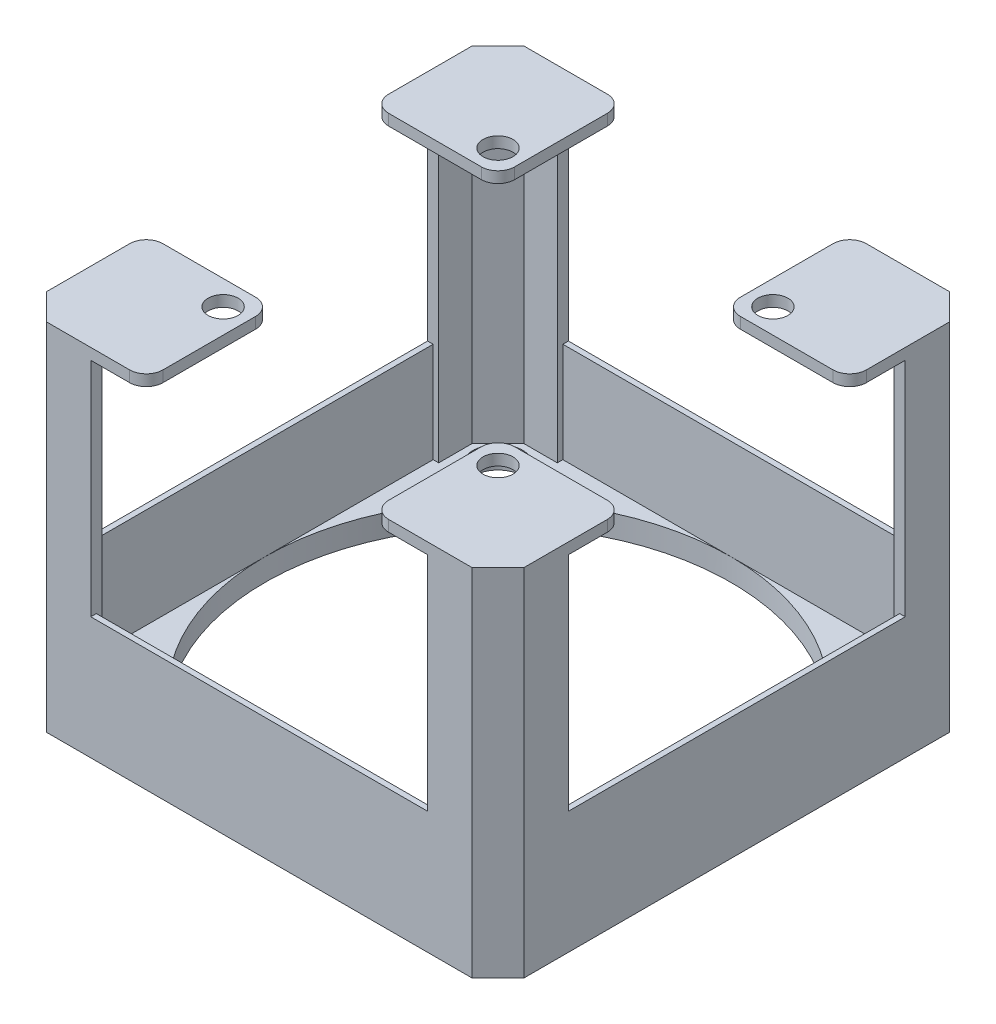
from build123d import *

# Parameters (mm, degrees)
SKETCH1_R           = 21
BOSS_EXTRUDE1_DEPTH = 2
BOSS_EXTRUDE6_DEPTH = 30
SKETCH13_W          = 30.324405
SKETCH13_H          = 0.5
SKETCH13_W_2        = 0.5
SKETCH13_H_2        = 30.324404
SKETCH13_W_3        = 30.32440476
SKETCH13_H_3        = 0.50000019
BOSS_EXTRUDE7_DEPTH = 9
SKETCH15_R          = 1.35
BOSS_EXTRUDE9_DEPTH = 1
SKETCH16_R          = 2.25
CUT_EXTRUDE1_DEPTH  = 67.350694814


with BuildPart() as part:
    # Sketch1 → Boss-Extrude1 (new body)
    with BuildSketch(Plane(origin=(0, 0, 0), x_dir=(1, 0, 0), z_dir=(0, 1, 0))):
        Polygon((-2.33779762, 2.33779762), (0, 0), (38.32440476, 0), (40.66220238, 2.33779762), (40.66220238, 40.66220238), (38.32440476, 43), (0, 43), (-2.33779762, 40.66220238), align=None)
        with Locations((19.16220238, 21.5)):
            Circle(SKETCH1_R, mode=Mode.SUBTRACT)
    extrude(amount=BOSS_EXTRUDE1_DEPTH)

    # Sketch3 → Boss-Extrude6 (add)
    with BuildSketch(Plane(origin=(0, 2, 0), x_dir=(1, 0, 0), z_dir=(0, 1, 0))):
        Polygon((-2.33779762, 2.33779762), (0, 0), (4, 0), (4, 1), (1, 1), (-1.33779762, 3.337798), (-1.33779762, 6.337798), (-2.33779762, 6.337798), align=None)
        Polygon((34.324405, 1), (34.324405, 0), (38.32440476, 0), (40.66220238, 2.33779762), (40.66220238, 6.337798), (39.66220238, 6.337798), (39.66220238, 3.33779738), (37.324405, 1), align=None)
        Polygon((-2.33779762, 40.66220238), (-2.33779762, 36.662202), (-1.33779762, 36.662202), (-1.33779762, 39.662202), (1, 41.99999962), (4, 41.99999962), (4, 43), (0, 43), align=None)
        Polygon((39.66220238, 36.662202), (40.66220238, 36.662202), (40.66220238, 40.66220238), (38.32440476, 43), (34.32440476, 43), (34.32440476, 41.99999962), (37.32440476, 41.99999962), (39.66220238, 39.662202), align=None)
    extrude(amount=BOSS_EXTRUDE6_DEPTH)

    # Sketch13 → Boss-Extrude7 (add)
    with BuildSketch(Plane(origin=(0, 2, 0), x_dir=(1, 0, 0), z_dir=(0, 1, 0))):
        with Locations((19.1622025, 0.25)):
            Rectangle(SKETCH13_W, SKETCH13_H)
        with Locations((40.41220238, 21.5)):
            Rectangle(SKETCH13_W_2, SKETCH13_H_2)
        with Locations((19.16220238, 42.749999905)):
            Rectangle(SKETCH13_W_3, SKETCH13_H_3)
        with Locations((-2.08779762, 21.5)):
            Rectangle(SKETCH13_W_2, SKETCH13_H_2)
    extrude(amount=BOSS_EXTRUDE7_DEPTH)

    # Sketch15 → Boss-Extrude9 (add)
    # profile 1 of 4: a face of its own
    with BuildSketch(Plane(origin=(0, 32, 0), x_dir=(1, 0, 0), z_dir=(0, 1, 0))):
        with BuildLine():
            Line((30.82440476, 31.662202), (31.53657138, 31.662202))
            Line((31.53657138, 31.662202), (39.16220238, 31.662202))
            ThreePointArc((39.16220238, 31.662202), (40.222862552, 32.101541828), (40.66220238, 33.162202))
            Line((40.66220238, 33.162202), (40.66220238, 36.662202))
            Line((40.66220238, 36.662202), (39.66220238, 36.662202))
            Line((39.66220238, 36.662202), (39.66220238, 39.662202))
            Line((39.66220238, 39.662202), (37.32440476, 41.99999962))
            Line((37.32440476, 41.99999962), (34.32440476, 41.99999962))
            Line((34.32440476, 41.99999962), (34.32440476, 43))
            Line((34.32440476, 43), (30.82440476, 43))
            ThreePointArc((30.82440476, 43), (29.763744588, 42.560660171), (29.32440476, 41.5))
            Line((29.32440476, 41.5), (29.32440476, 33.162202))
            ThreePointArc((29.32440476, 33.162202), (29.763744588, 32.101541828), (30.82440476, 31.662202))
        make_face()
        with Locations((31.53657138, 33.874369)):
            Circle(SKETCH15_R, mode=Mode.SUBTRACT)
    # profile 2 of 4: a face of its own
    with BuildSketch(Plane(origin=(0, 32, 0), x_dir=(1, 0, 0), z_dir=(0, 1, 0))):
        with BuildLine():
            Line((9, 1.5), (9, 9.125631))
            Line((9, 9.125631), (9, 9.837798))
            ThreePointArc((9, 9.837798), (8.560660172, 10.898458172), (7.5, 11.337798))
            Line((7.5, 11.337798), (-0.83779762, 11.337798))
            ThreePointArc((-0.83779762, 11.337798), (-1.898457792, 10.898458172), (-2.33779762, 9.837798))
            Line((-2.33779762, 9.837798), (-2.33779762, 2.33779762))
            Line((-2.33779762, 2.33779762), (0, 0))
            Line((0, 0), (7.5, 0))
            ThreePointArc((7.5, 0), (8.560660172, 0.439339828), (9, 1.5))
        make_face()
        with Locations((6.78783338, 9.125631)):
            Circle(SKETCH15_R, mode=Mode.SUBTRACT)
    # profile 3 of 4: a face of its own
    with BuildSketch(Plane(origin=(0, 32, 0), x_dir=(1, 0, 0), z_dir=(0, 1, 0))):
        with BuildLine():
            ThreePointArc((40.66220238, 9.837798), (40.222862552, 10.898458172), (39.16220238, 11.337798))
            Line((39.16220238, 11.337798), (30.82440476, 11.337798))
            ThreePointArc((30.82440476, 11.337798), (29.763744588, 10.898458172), (29.32440476, 9.837798))
            Line((29.32440476, 9.837798), (29.32440476, 1.5))
            ThreePointArc((29.32440476, 1.5), (29.763744588, 0.439339828), (30.82440476, 0))
            Line((30.82440476, 0), (38.32440476, 0))
            Line((38.32440476, 0), (40.66220238, 2.33779762))
            Line((40.66220238, 2.33779762), (40.66220238, 9.837798))
        make_face()
        with Locations((31.53657138, 9.125631)):
            Circle(SKETCH15_R, mode=Mode.SUBTRACT)
    # profile 4 of 4: a face of its own
    with BuildSketch(Plane(origin=(0, 32, 0), x_dir=(1, 0, 0), z_dir=(0, 1, 0))):
        with BuildLine():
            ThreePointArc((-2.33779762, 33.162202), (-1.898457792, 32.101541828), (-0.83779762, 31.662202))
            Line((-0.83779762, 31.662202), (7.5, 31.662202))
            ThreePointArc((7.5, 31.662202), (8.560660172, 32.101541828), (9, 33.162202))
            Line((9, 33.162202), (9, 41.5))
            ThreePointArc((9, 41.5), (8.560660172, 42.560660171), (7.5, 43))
            Line((7.5, 43), (0, 43))
            Line((0, 43), (-2.33779762, 40.66220238))
            Line((-2.33779762, 40.66220238), (-2.33779762, 33.162202))
        make_face()
        with Locations((6.78783338, 33.874369)):
            Circle(SKETCH15_R, mode=Mode.SUBTRACT)
    extrude(amount=-BOSS_EXTRUDE9_DEPTH)

    # Sketch16 → Cut-Extrude1 (cut, through all)
    with BuildSketch(Plane(origin=(0, 2, 0), x_dir=(1, 0, 0), z_dir=(0, 1, 0))):
        with Locations((36.83987191, 39.177669529)):
            Circle(SKETCH16_R)
        with Locations((36.83987191, 3.82233047)):
            Circle(SKETCH16_R)
        with Locations((1.48453285, 3.82233047)):
            Circle(SKETCH16_R)
        with Locations((1.48453285, 39.177669529)):
            Circle(SKETCH16_R)
    extrude(amount=-CUT_EXTRUDE1_DEPTH, mode=Mode.SUBTRACT)


solid = part.part
